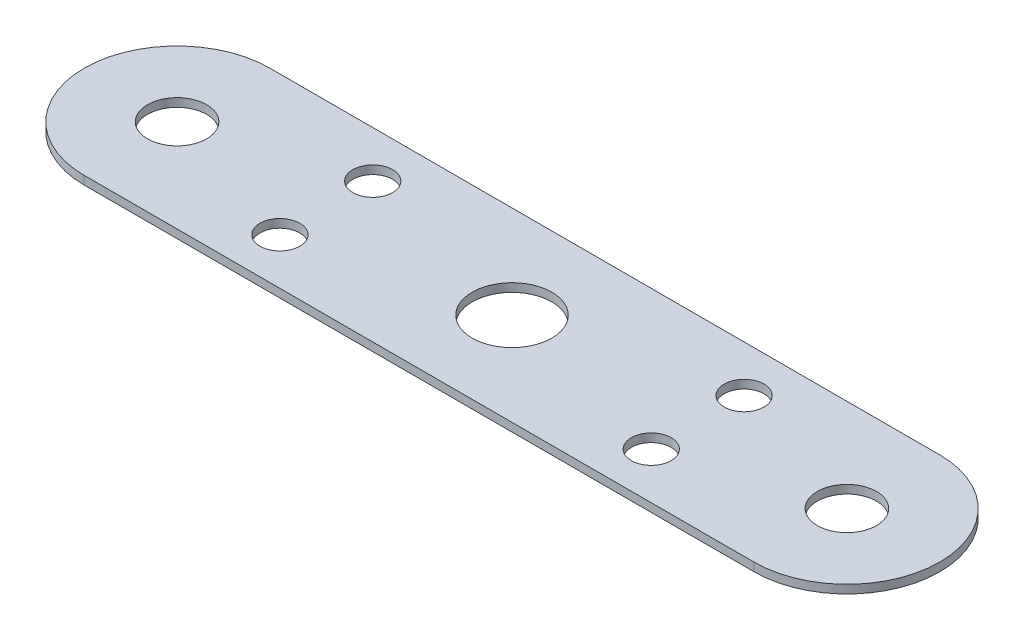
from build123d import *

# Parameters (mm, degrees)
SKETCH1_R           = 15
SKETCH1_R_2         = 7.5
SKETCH1_R_3         = 11.15
BOSS_EXTRUDE1_DEPTH = 3.175


with BuildPart() as part:
    # Sketch1 → Boss-Extrude1 (new body)
    with BuildSketch(Plane(origin=(0, 0, 0), x_dir=(1, 0, 0), z_dir=(0, 1, 0))):
        with BuildLine():
            Line((126.258214395, 35), (-126.258214395, 35))
            ThreePointArc((-126.258214395, 35), (-161.258214395, 0), (-126.258214395, -35))
            Line((-126.258214395, -35), (126.258214395, -35))
            ThreePointArc((126.258214395, -35), (161.258214395, 0), (126.258214395, 35))
        make_face()
        Circle(SKETCH1_R, mode=Mode.SUBTRACT)
        with Locations((-70, 17.5)):
            Circle(SKETCH1_R_2, mode=Mode.SUBTRACT)
        with Locations((70, 17.5)):
            Circle(SKETCH1_R_2, mode=Mode.SUBTRACT)
        with Locations((-126.258214395, 0)):
            Circle(SKETCH1_R_3, mode=Mode.SUBTRACT)
        with Locations((126.258214395, 0)):
            Circle(SKETCH1_R_3, mode=Mode.SUBTRACT)
        with Locations((-70, -17.5)):
            Circle(SKETCH1_R_2, mode=Mode.SUBTRACT)
        with Locations((70, -17.5)):
            Circle(SKETCH1_R_2, mode=Mode.SUBTRACT)
    extrude(amount=BOSS_EXTRUDE1_DEPTH)


solid = part.part
